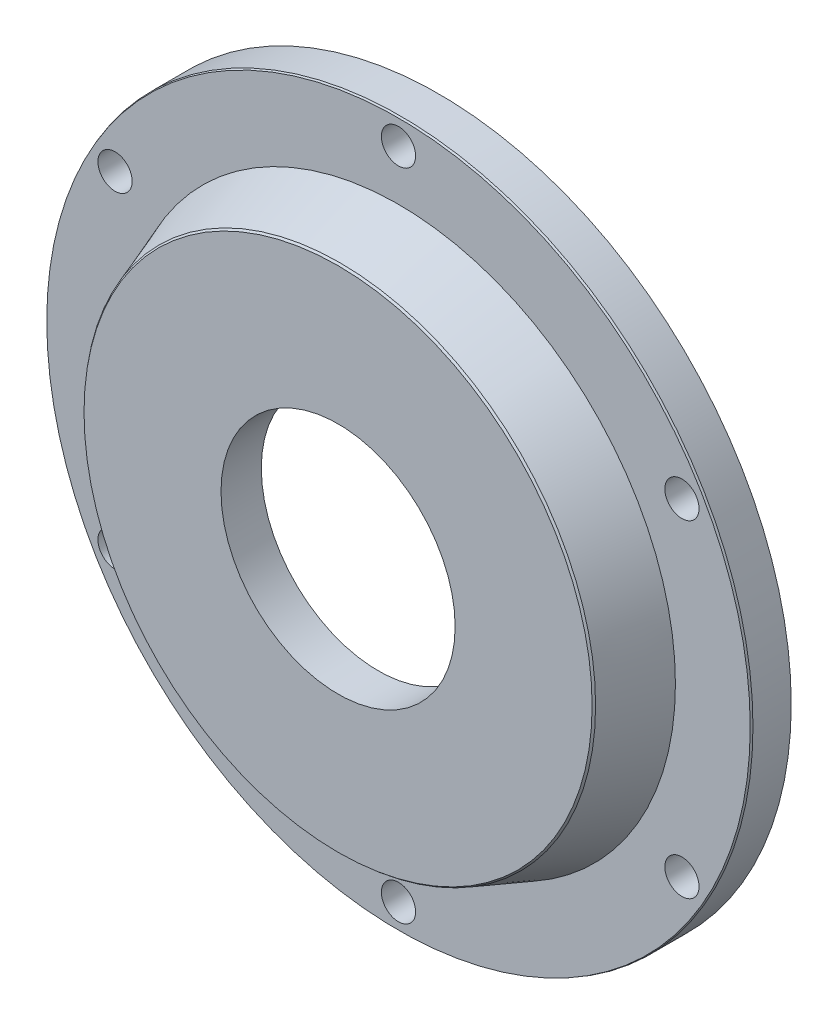
from build123d import *
from OCP.BRepFilletAPI import BRepFilletAPI_MakeChamfer

# Parameters (mm, degrees)
SKETCH1_R            = 35
BOSS_EXTRUDE1_DEPTH  = 10
SKETCH2_R            = 26.5
CUT_EXTRUDE1_DEPTH   = 6
CHAMFER1_SIZE        = 3.5
SKETCH5_R            = 35
SKETCH5_R_2          = 27.5
CUT_EXTRUDE3_DEPTH   = 6
CHAMFER3_SIZE        = 6
CHAMFER3_SIZE_2      = 2.183821406
SKETCH6_R            = 11.625
CUT_EXTRUDE4_DEPTH   = 6
M3_CLEARANCE_HOLE1_D = 3.4
CIRPATTERN1_COUNT    = 6
CHAMFER4_SIZE        = 0.2
CHAMFER4_SIZE2       = 0.072794047
CHAMFER4_SIZE2_2     = 0.089295118


with BuildPart() as part:
    # Sketch1 → Boss-Extrude1 (new body)
    with BuildSketch(Plane.XY):
        Circle(SKETCH1_R)
    extrude(amount=-BOSS_EXTRUDE1_DEPTH)

    # Sketch2 → Cut-Extrude1 (cut)
    with BuildSketch(Plane(origin=(0, 0, -10), x_dir=(-1, 0, 0), z_dir=(0, 0, -1))):
        Circle(SKETCH2_R)
    extrude(amount=-CUT_EXTRUDE1_DEPTH, mode=Mode.SUBTRACT)

    # Chamfer1
    chamfer1_edges = [part.edges().sort_by_distance(p)[0] for p in [
        (26.5, 0, -10),
    ]]
    chamfer(chamfer1_edges, length=CHAMFER1_SIZE)

    # Sketch5 → Cut-Extrude3 (cut)
    with BuildSketch(Plane.XY):
        Circle(SKETCH5_R)
        Circle(SKETCH5_R_2, mode=Mode.SUBTRACT)
    extrude(amount=-CUT_EXTRUDE3_DEPTH, mode=Mode.SUBTRACT)

    # Chamfer3
    # the kernel refuses this chamfer: 6, 2.183821406 mm, written as the material it takes off along each edge
    with BuildSketch(Plane(origin=(0, 0, 0), x_dir=(1, 0, 0), z_dir=(0, -1, 0))) as chamfer3_piece_1_section:
        Polygon((27.5, -CHAMFER3_SIZE), (27.5 - CHAMFER3_SIZE_2, 0), (27.5, 0), align=None)
    chamfer3_piece_1 = revolve(axis=Axis((0, 0, 0), (0, 0, 1)), mode=Mode.PRIVATE)
    chamfer3_piece_1 = split(chamfer3_piece_1, bisect_by=Plane(origin=(-26.469518779, 0, -6), z_dir=(0, 0, 1)), keep=Keep.TOP, mode=Mode.PRIVATE)
    add(chamfer3_piece_1, mode=Mode.SUBTRACT)

    # Sketch6 → Cut-Extrude4 (cut)
    with BuildSketch(Plane.XY):
        Circle(SKETCH6_R)
    extrude(amount=-CUT_EXTRUDE4_DEPTH, mode=Mode.SUBTRACT)

    # M3 Clearance Hole1 (through all)
    with Locations(Plane(origin=(0, 32.5, -6), x_dir=(1, 0, 0), z_dir=(0, 0, 1))):
        with Locations((0, 0)):
            m3_clearance_hole1 = Hole(M3_CLEARANCE_HOLE1_D / 2)

    # CirPattern1: M3 Clearance Hole1 ×6 about axis
    cirpattern1_axis = Axis((0, 0, 0), (0, 0, 1))
    for i in range(1, CIRPATTERN1_COUNT):
        add(m3_clearance_hole1.rotate(cirpattern1_axis, i * 360 / CIRPATTERN1_COUNT), mode=Mode.SUBTRACT)

    # Chamfer4: one chamfer whose edges measure the first distance from different faces: ONE call of the kernel's chamfer builder (chamfer() names one face for all edges)
    chamfer4_edges_1 = [part.edges().sort_by_distance(p)[0] for p in [
        (-35, 0, -6),
    ]]
    chamfer4_side_1 = [part.faces().sort_by_distance(p)[0] for p in [
        (-35, 0, -8),
    ]]
    chamfer4_edges_2 = [part.edges().sort_by_distance(p)[0] for p in [
        (-25.316178594, 0, 0),
    ]]
    chamfer4_side_2 = [part.faces().sort_by_distance(p)[0] for p in [
        (-26.408089297, 0, -3),
    ]]
    chamfer4 = BRepFilletAPI_MakeChamfer(part.part.solid().wrapped)
    for e in chamfer4_edges_1:
        chamfer4.Add(CHAMFER4_SIZE, CHAMFER4_SIZE2, e.wrapped, chamfer4_side_1[0].wrapped)  # the first distance lies on this face
    for e in chamfer4_edges_2:
        chamfer4.Add(CHAMFER4_SIZE, CHAMFER4_SIZE2_2, e.wrapped, chamfer4_side_2[0].wrapped)  # the first distance lies on this face
    add(Compound.cast(chamfer4.Shape()), mode=Mode.REPLACE)


solid = part.part
